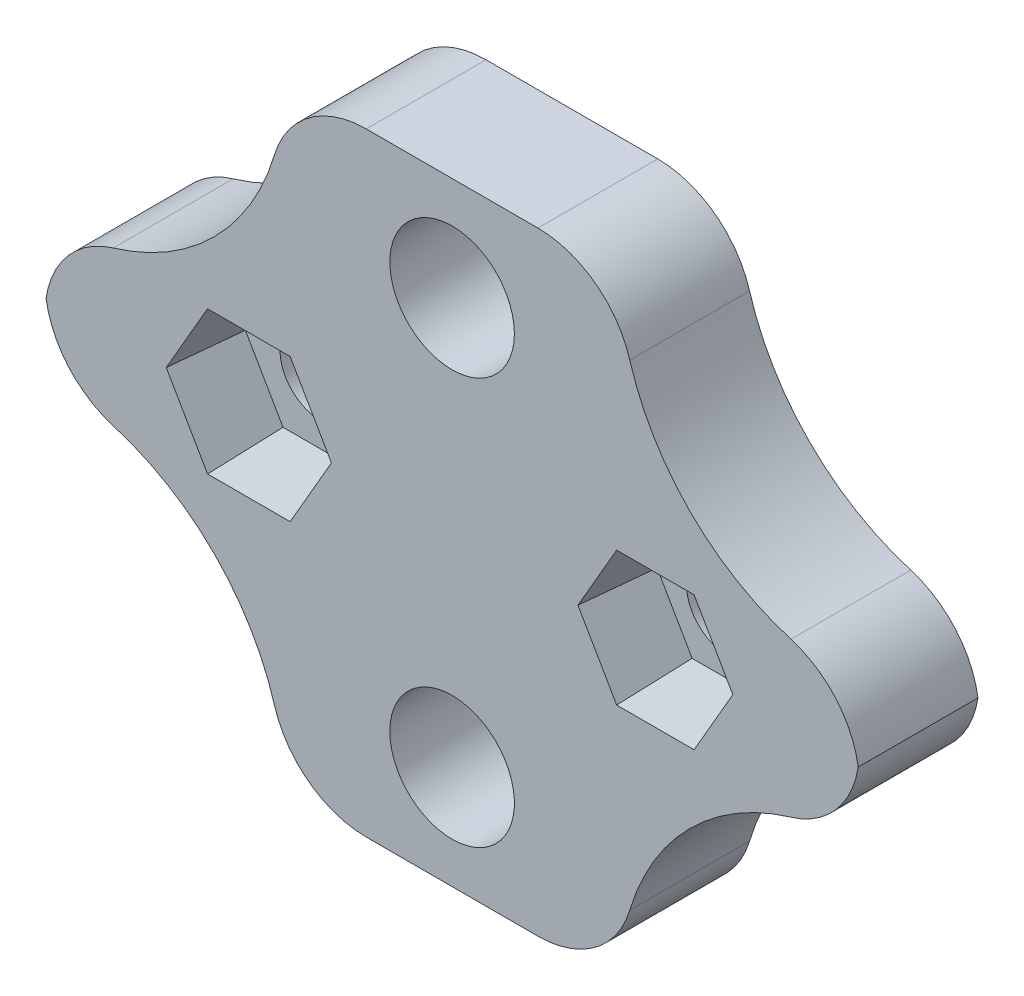
from build123d import *

# Parameters (mm, degrees)
ESQUISSE1_W                       = 34
ESQUISSE1_H                       = 25.6
ESQUISSE1_R                       = 1.7
ESQUISSE1_R_2                     = 2.6
BOSS_EXTRU_1_DEPTH                = 5
ENL_V_MAT_EXTRU_2_DEPTH           = 3
ENL_V_MAT_EXTRU_2_DRAFT           = -5
ENL_V_MAT_EXTRU_2_PROFILE_2_DEPTH = 3
ENL_V_MAT_EXTRU_2_PROFILE_2_DRAFT = -5
ENL_V_MAT_EXTRU_3_DEPTH           = 10
CONG_1_R                          = 4


with BuildPart() as part:
    # Esquisse1 → Boss.-Extru.1 (new body)
    with BuildSketch(Plane.XY):
        with Locations((-3.241443597, 0)):
            Rectangle(ESQUISSE1_W, ESQUISSE1_H)
        with Locations((-11.726724972, 0)):
            Circle(ESQUISSE1_R, mode=Mode.SUBTRACT)
        with Locations((-3.241443597, 8.485281374)):
            Circle(ESQUISSE1_R_2, mode=Mode.SUBTRACT)
        with Locations(Location((-3.241443597, -8.485281374, 0), (0, 0, 180))):
            Circle(ESQUISSE1_R_2, mode=Mode.SUBTRACT)
        with Locations(Location((5.243837777, 0, 0), (0, 0, 180))):
            Circle(ESQUISSE1_R, mode=Mode.SUBTRACT)
    extrude(amount=BOSS_EXTRU_1_DEPTH)


with BuildPart() as enl_v_mat_extru_2_tool:
    # Esquisse3 → Enlèv. mat.-Extru.2 (with draft: the straight prism first)
    with BuildSketch(Plane.XY.offset(5)):
        Polygon((-8.278451106, 0), (-10.002588039, 2.986292767), (-13.450861905, 2.986292767), (-15.174998837, 0), (-13.450861905, -2.986292767), (-10.002588039, -2.986292767), align=None)
    extrude(amount=-ENL_V_MAT_EXTRU_2_DEPTH)
    # Enlèv. mat.-Extru.2: the draft: its side faces are tilted about the plane it starts from
    enl_v_mat_extru_2_sides = [enl_v_mat_extru_2_tool.faces().sort_by_distance(p)[0] for p in [
        (-9.140519572, 1.493146384, 3.5),
        (-11.726724972, 2.986292767, 3.5),
        (-14.312930371, 1.493146384, 3.5),
        (-14.312930371, -1.493146384, 3.5),
        (-11.726724972, -2.986292767, 3.5),
        (-9.140519572, -1.493146384, 3.5),
    ]]
    draft(enl_v_mat_extru_2_sides, Plane.XY.offset(5), ENL_V_MAT_EXTRU_2_DRAFT)


with BuildPart() as part_1:
    add(part.part)

    # Enlèv. mat.-Extru.2: cut by enl_v_mat_extru_2_tool
    add(enl_v_mat_extru_2_tool.part, mode=Mode.SUBTRACT)


with BuildPart() as enl_v_mat_extru_2_profile_2_tool:
    # Esquisse3 → Enlèv. mat.-Extru.2 profile 2 (with draft: the straight prism first)
    with BuildSketch(Plane.XY.offset(5)):
        Polygon((8.476999284, 0), (6.860418531, 2.8), (3.627257023, 2.8), (2.010676269, 0), (3.627257023, -2.8), (6.860418531, -2.8), align=None)
    extrude(amount=-ENL_V_MAT_EXTRU_2_PROFILE_2_DEPTH)
    # Enlèv. mat.-Extru.2 profile 2: the draft: its side faces are tilted about the plane it starts from
    enl_v_mat_extru_2_profile_2_sides = [enl_v_mat_extru_2_profile_2_tool.faces().sort_by_distance(p)[0] for p in [
        (7.668708907, 1.4, 3.5),
        (5.243837777, 2.8, 3.5),
        (2.818966646, 1.4, 3.5),
        (2.818966646, -1.4, 3.5),
        (5.243837777, -2.8, 3.5),
        (7.668708907, -1.4, 3.5),
    ]]
    draft(enl_v_mat_extru_2_profile_2_sides, Plane.XY.offset(5), ENL_V_MAT_EXTRU_2_PROFILE_2_DRAFT)


with BuildPart() as part_2:
    add(part_1.part)

    # Enlèv. mat.-Extru.2 profile 2: cut by enl_v_mat_extru_2_profile_2_tool
    add(enl_v_mat_extru_2_profile_2_tool.part, mode=Mode.SUBTRACT)

    # Esquisse4 → Enlèv. mat.-Extru.3 (cut)
    with BuildSketch(Plane(origin=(0, 0, 0), x_dir=(-1, 0, 0), z_dir=(0, 0, -1))):
        with BuildLine():
            Line((10.241443597, 12.8), (20.241443597, 12.8))
            Line((20.241443597, 12.8), (20.241443597, 2.8))
            ThreePointArc((20.241443597, 2.8), (13.170375785, 5.728932188), (10.241443597, 12.8))
        make_face()
        with BuildLine():
            Line((20.241443597, -12.8), (20.241443597, -2.8))
            ThreePointArc((20.241443597, -2.8), (13.170375785, -5.728932188), (10.241443597, -12.8))
            Line((10.241443597, -12.8), (20.241443597, -12.8))
        make_face()
        with BuildLine():
            Line((-3.758556403, -12.8), (-13.758556403, -12.8))
            Line((-13.758556403, -12.8), (-13.758556403, -2.8))
            ThreePointArc((-13.758556403, -2.8), (-6.687488591, -5.728932188), (-3.758556403, -12.8))
        make_face()
        with BuildLine():
            Line((-13.758556403, 12.8), (-13.758556403, 2.8))
            ThreePointArc((-13.758556403, 2.8), (-6.687488591, 5.728932188), (-3.758556403, 12.8))
            Line((-3.758556403, 12.8), (-13.758556403, 12.8))
        make_face()
    extrude(amount=-ENL_V_MAT_EXTRU_3_DEPTH, mode=Mode.SUBTRACT)

    # Congé1
    # the kernel refuses this fillet: 4 mm, written as the material it takes off along each edge
    with BuildSketch(Plane(origin=(-10.241443597, -12.8, -8.541019662), x_dir=(1, 0, 0), z_dir=(0, 0, 1)), Plane(origin=(-20.241443597, 2.8, -8.541019662), x_dir=(0, -1, 0), z_dir=(0, 0, 1)), Plane(origin=(3.758556403, 12.8, -8.541019662), x_dir=(-1, 0, 0), z_dir=(0, 0, 1))) as cong_1_piece_1:
        with BuildLine():
            CenterArc((3.416407865, 4), CONG_1_R, 196.601549599, 73.398450401)
            ThreePointArc((-0.416851525, 2.857142857), (-0.104761631, 1.443695821), (0, 0))
            Line((0, 0), (3.416407865, 0))
        make_face()
    extrude(amount=22.082039325, mode=Mode.SUBTRACT)
    with BuildSketch(Plane(origin=(-20.241443597, -2.8, -8.541019662), x_dir=(0.9895238368781002, -0.14436958214957515, 0), z_dir=(0, 0, 1)), Plane(origin=(-10.241443597, 12.8, -8.541019662), x_dir=(-0.14436958214957388, -0.9895238368781005, 0), z_dir=(0, 0, 1)), Plane(origin=(13.758556403, 2.8, -8.541019662), x_dir=(-0.9895238368781005, 0.14436958214957332, 0), z_dir=(0, 0, 1))) as cong_1_piece_2:
        with BuildLine():
            CenterArc((3.464869972, 3.958095348), CONG_1_R, 188.300774799, 73.398450401)
            Line((-0.493225376, 3.380617019), (0, 0))
            ThreePointArc((0, 0), (1.443695821, 0.104761631), (2.887391643, 0))
        make_face()
    extrude(amount=22.082039325, mode=Mode.SUBTRACT)
    with BuildSketch(Plane(origin=(3.758556403, -12.8, -8.541019662), x_dir=(-1, 0, 0), z_dir=(0, 0, 1))) as cong_1_piece_3:
        with BuildLine():
            CenterArc((3.416407865, -4), CONG_1_R, 90, 73.398450401)
            ThreePointArc((-0.416851525, -2.857142857), (-0.104761631, -1.443695821), (0, 0))
            Line((0, 0), (3.416407865, 0))
        make_face()
    extrude(amount=22.082039325, mode=Mode.SUBTRACT)
    with BuildSketch(Plane(origin=(13.758556403, -2.8, -8.541019662), x_dir=(-0.9895238368781001, -0.14436958214957546, 0), z_dir=(0, 0, 1))) as cong_1_piece_4:
        with BuildLine():
            CenterArc((3.464869972, -3.958095348), CONG_1_R, 98.3007748, 73.398450401)
            Line((-0.493225376, -3.380617019), (0, 0))
            ThreePointArc((0, 0), (1.443695821, -0.104761631), (2.887391643, 0))
        make_face()
    extrude(amount=22.082039325, mode=Mode.SUBTRACT)


solid = part_2.part
